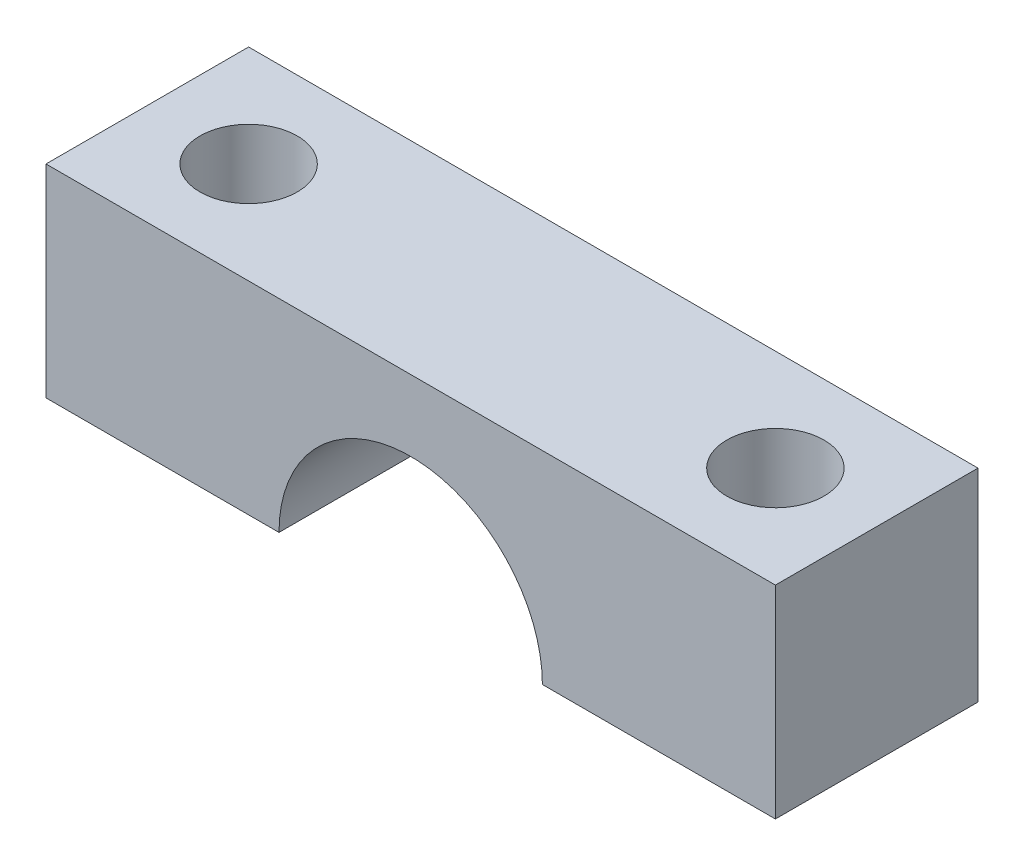
from build123d import *

# Parameters (mm, degrees)
BOSS_EXTRUDE1_DEPTH = 5
SKETCH2_R           = 1.2
CUT_EXTRUDE1_DEPTH  = 12.445523142


with BuildPart() as part:
    # Sketch1 → Boss-Extrude1 (new body)
    with BuildSketch(Plane.XY):
        with BuildLine():
            Line((3.25, 0), (9, 0))
            Line((9, 0), (9, 5))
            Line((9, 5), (-9, 5))
            Line((-9, 5), (-9, 0))
            Line((-9, 0), (-3.25, 0))
            ThreePointArc((-3.25, 0), (0, 3.25), (3.25, 0))
        make_face()
    extrude(amount=BOSS_EXTRUDE1_DEPTH)

    # Sketch2 → Cut-Extrude1 (cut, through all)
    with BuildSketch(Plane(origin=(0, 0, 0), x_dir=(1, 0, 0), z_dir=(0, 1, 0))):
        with Locations((-6.5, -2.5)):
            Circle(SKETCH2_R)
        with Locations((6.5, -2.5)):
            Circle(SKETCH2_R)
    extrude(amount=CUT_EXTRUDE1_DEPTH, mode=Mode.SUBTRACT)


solid = part.part
